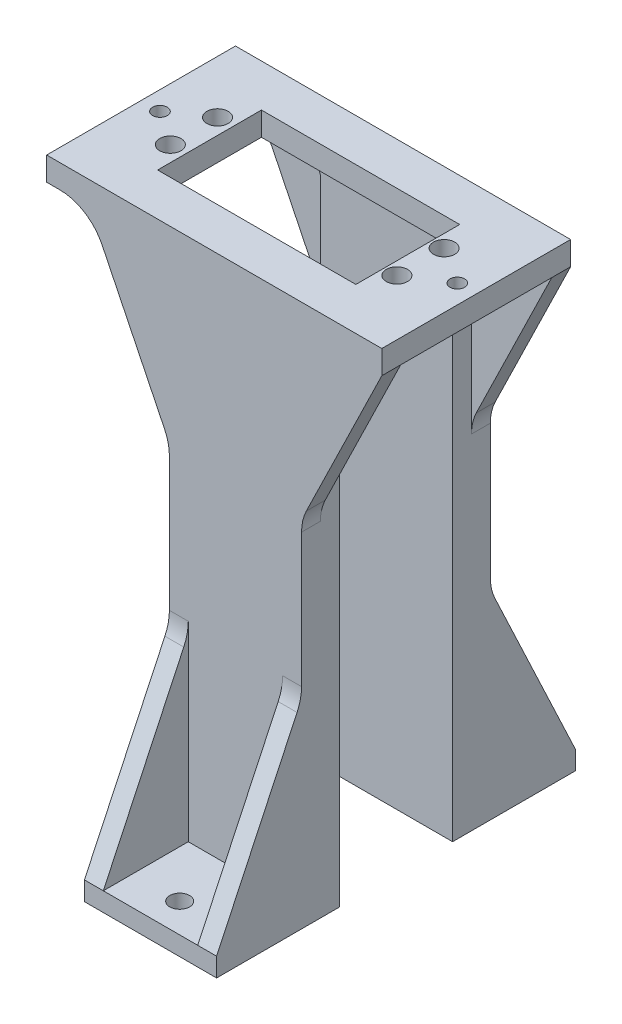
from build123d import *

# Parameters (mm, degrees)
SKETCH_1_W                                = 36
SKETCH_1_H                                = 30
EXTRUDE_1_DEPTH                           = 5
SKETCH_11_W                               = 36
SKETCH_11_H                               = 8
EXTRUDE_3_DEPTH                           = 110
SKETCH_12_W                               = 36
SKETCH_12_H                               = 8
EXTRUDE_4_DEPTH                           = 4
SKETCH_17_W                               = 36
SKETCH_17_H                               = 5
EXTRUDE_5_DEPTH                           = 8
SKETCH_18_W                               = 36
SKETCH_18_H                               = 5
EXTRUDE_6_DEPTH                           = 8
SKETCH_20_W                               = 36
SKETCH_20_H                               = 4
EXTRUDE_7_DEPTH                           = 15
SKETCH_21_W                               = 36
SKETCH_21_H                               = 4
EXTRUDE_8_DEPTH                           = 15
CUT_EXTRUDE_8_REACH                       = 124.446
SKETCH_22_R                               = 2.1
CUT_EXTRUDE_9_REACH                       = 124.446
SKETCH_23_R                               = 1.55
CUT_EXTRUDE_10_REACH                      = 119.762
SKETCH_26_R                               = 1
SKETCH_26_W                               = 23.5
SKETCH_26_H                               = 12
CUT_EXTRUDE_11_DEPTH                      = 2
CUT_EXTRUDE_12_DEPTH                      = 2
CUT_EXTRUDE_13_DEPTH                      = 2
CUT_EXTRUDE_14_DEPTH                      = 2
SKETCH_32_W                               = 28
SKETCH_32_H                               = 106
CUT_EXTRUDE_15_DEPTH                      = 2
SKETCH_33_W                               = 28
SKETCH_33_H                               = 106
CUT_EXTRUDE_16_DEPTH                      = 2
EXTRUDE_START                             = 2
SKETCH_34_W                               = 32
SKETCH_34_H                               = 14.000594261
SKETCH_34_R                               = 1
SKETCH_34_W_2                             = 23.5
SKETCH_34_H_2                             = 12
EXTRUDE_12_DEPTH                          = 2
CUT_EXTRUDE_START                         = -2
CUT_EXTRUDE_17_OUTLINE_R                  = 1
CUT_EXTRUDE_17_OUTLINE_W                  = 23.5
CUT_EXTRUDE_17_OUTLINE_H                  = 12
CUT_EXTRUDE_17_DEPTH                      = 2
SKETCH_36_W                               = 46
SKETCH_36_H                               = 5
EXTRUDE_13_DEPTH                          = 15
SKETCH_37_W                               = 46
SKETCH_37_H                               = 5
EXTRUDE_14_DEPTH                          = 15
SKETCH_38_R                               = 1.55
CUT_EXTRUDE_18_DEPTH                      = 5
CUT_EXTRUDE_19_REACH                      = 122.437
SKETCH_39_W                               = 62
SKETCH_39_H                               = 10
FILLET_3_R                                = 2
EXTRUDE_15_DEPTH                          = 7
EXTRUDE_16_DEPTH                          = 7
CUT_EXTRUDE_20_DEPTH                      = 5
CUT_EXTRUDE_21_DEPTH                      = 5
CUT_EXTRUDE_22_DEPTH                      = 5
SKETCH_46_W                               = 9
SKETCH_46_H                               = 40
SKETCH_46_R                               = 1.55
EXTRUDE_17_DEPTH                          = 5
EXTRUDE_18_DEPTH                          = 5
SKETCH_48_R                               = 2.25
CUT_EXTRUDE_23_DEPTH                      = 10
EXTRUDE_19_DEPTH                          = 4
MIRROR_1_AT_THE_SECOND_PLANE_COPY_1_DEPTH = 4
EXTRUDE_20_DEPTH                          = 4
MIRROR_2_AT_THE_SECOND_PLANE_COPY_1_DEPTH = 4
FILLET_4_R                                = 10


# Read off the part's stored shape, not the designer's step: 切除-拉伸17
with BuildPart() as part:
    # 草图1 → 凸台-拉伸1 (new body)
    with BuildSketch(Plane(origin=(0, 0, 0), x_dir=(1, 0, 0), z_dir=(0, 1, 0))):
        Rectangle(SKETCH_1_W, SKETCH_1_H)
    extrude(amount=EXTRUDE_1_DEPTH)

    # 草图11 → 凸台-拉伸3 (add)
    with BuildSketch(Plane.XZ):
        with Locations((0, 11)):
            Rectangle(SKETCH_11_W, SKETCH_11_H)
        with Locations((0, -11)):
            Rectangle(SKETCH_11_W, SKETCH_11_H)
    extrude(amount=EXTRUDE_3_DEPTH)

    # 草图12 → 凸台-拉伸4 (add)
    with BuildSketch(Plane.XZ.offset(110)):
        with Locations((0, 19)):
            Rectangle(SKETCH_12_W, SKETCH_12_H)
        with Locations((0, -19)):
            Rectangle(SKETCH_12_W, SKETCH_12_H)
    extrude(amount=-EXTRUDE_4_DEPTH)

    # 草图17 → 凸台-拉伸5 (add)
    with BuildSketch(Plane(origin=(0, 0, -15), x_dir=(-1, 0, 0), z_dir=(0, 0, -1))):
        with Locations((0, 2.5)):
            Rectangle(SKETCH_17_W, SKETCH_17_H)
    extrude(amount=EXTRUDE_5_DEPTH)

    # 草图18 → 凸台-拉伸6 (add)
    with BuildSketch(Plane.XY.offset(15)):
        with Locations((0, 2.5)):
            Rectangle(SKETCH_18_W, SKETCH_18_H)
    extrude(amount=EXTRUDE_6_DEPTH)

    # 草图20 → 凸台-拉伸7 (add)
    with BuildSketch(Plane.XY.offset(23)):
        with Locations((0, -108)):
            Rectangle(SKETCH_20_W, SKETCH_20_H)
    extrude(amount=EXTRUDE_7_DEPTH)

    # 草图21 → 凸台-拉伸8 (add)
    with BuildSketch(Plane(origin=(0, 0, -23), x_dir=(-1, 0, 0), z_dir=(0, 0, -1))):
        with Locations((0, -108)):
            Rectangle(SKETCH_21_W, SKETCH_21_H)
    extrude(amount=EXTRUDE_8_DEPTH)

    # 草图22 → 切除-拉伸8 (cut, up to next)
    with BuildSketch(Plane.XZ.offset(110), mode=Mode.PRIVATE) as cut_extrude_8_sk1:
        with Locations(Location((0, 31.819805155, 0), (0, 0, 270))):
            Circle(SKETCH_22_R)
    cut_extrude_8_tool1 = extrude(cut_extrude_8_sk1.sketch, amount=-CUT_EXTRUDE_8_REACH, mode=Mode.PRIVATE) & part.part
    # 草图22 → 切除-拉伸8 (cut, up to next)
    with BuildSketch(Plane.XZ.offset(110), mode=Mode.PRIVATE) as cut_extrude_8_sk2:
        with Locations(Location((0, -31.819805155, 0), (0, 0, 270))):
            Circle(SKETCH_22_R)
    cut_extrude_8_tool2 = extrude(cut_extrude_8_sk2.sketch, amount=-CUT_EXTRUDE_8_REACH, mode=Mode.PRIVATE) & part.part
    add(cut_extrude_8_tool1.solids().sort_by_distance((0, -110, 31.819805))[0], mode=Mode.SUBTRACT)
    add(cut_extrude_8_tool2.solids().sort_by_distance((0, -110, -31.819805))[0], mode=Mode.SUBTRACT)

    # 草图23 → 切除-拉伸9 (cut, up to next)
    with BuildSketch(Plane(origin=(0, 5, 0), x_dir=(1, 0, 0), z_dir=(0, 1, 0)), mode=Mode.PRIVATE) as cut_extrude_9_sk1:
        with Locations(Location((0, 18, 0), (0, 0, 270))):
            Circle(SKETCH_23_R)
    cut_extrude_9_tool1 = extrude(cut_extrude_9_sk1.sketch, amount=-CUT_EXTRUDE_9_REACH, mode=Mode.PRIVATE) & part.part
    # 草图23 → 切除-拉伸9 (cut, up to next)
    with BuildSketch(Plane(origin=(0, 5, 0), x_dir=(1, 0, 0), z_dir=(0, 1, 0)), mode=Mode.PRIVATE) as cut_extrude_9_sk2:
        with Locations(Location((0, -18, 0), (0, 0, 270))):
            Circle(SKETCH_23_R)
    cut_extrude_9_tool2 = extrude(cut_extrude_9_sk2.sketch, amount=-CUT_EXTRUDE_9_REACH, mode=Mode.PRIVATE) & part.part
    add(cut_extrude_9_tool1.solids().sort_by_distance((0, 5, -18))[0], mode=Mode.SUBTRACT)
    add(cut_extrude_9_tool2.solids().sort_by_distance((0, 5, 18))[0], mode=Mode.SUBTRACT)

    # 草图26 → 切除-拉伸10 (cut, up to next)
    with BuildSketch(Plane(origin=(0, 0, 0), x_dir=(-1, 0, 0), z_dir=(0, -1, 0)), mode=Mode.PRIVATE) as cut_extrude_10_sk1:
        with Locations(Location((-14, 0, 0), (0, 0, 90))):
            Circle(SKETCH_26_R)
    cut_extrude_10_tool1 = extrude(cut_extrude_10_sk1.sketch, amount=-CUT_EXTRUDE_10_REACH, mode=Mode.PRIVATE) & part.part
    # 草图26 → 切除-拉伸10 (cut, up to next)
    with BuildSketch(Plane(origin=(0, 0, 0), x_dir=(-1, 0, 0), z_dir=(0, -1, 0)), mode=Mode.PRIVATE) as cut_extrude_10_sk2:
        with Locations(Location((14, 0, 0), (0, 0, 270))):
            Circle(SKETCH_26_R)
    cut_extrude_10_tool2 = extrude(cut_extrude_10_sk2.sketch, amount=-CUT_EXTRUDE_10_REACH, mode=Mode.PRIVATE) & part.part
    # 草图26 → 切除-拉伸10 (cut, up to next)
    with BuildSketch(Plane(origin=(0, 0, 0), x_dir=(-1, 0, 0), z_dir=(0, -1, 0)), mode=Mode.PRIVATE) as cut_extrude_10_sk3:
        Rectangle(SKETCH_26_W, SKETCH_26_H)
    cut_extrude_10_tool3 = extrude(cut_extrude_10_sk3.sketch, amount=-CUT_EXTRUDE_10_REACH, mode=Mode.PRIVATE) & part.part
    add(cut_extrude_10_tool1.solids().sort_by_distance((14, 0, 0))[0], mode=Mode.SUBTRACT)
    add(cut_extrude_10_tool2.solids().sort_by_distance((-14, 0, 0))[0], mode=Mode.SUBTRACT)
    add(cut_extrude_10_tool3.solids().sort_by_distance((0, 0, 0))[0], mode=Mode.SUBTRACT)

    # 草图28 → 切除-拉伸11 (cut)
    with BuildSketch(Plane(origin=(18, 0, 0), x_dir=(0, 0, -1), z_dir=(1, 0, 0))):
        Polygon((23, 5), (-23, 5), (-23, 0), (-15, 0), (-15, -106), (-38, -106), (-38, -110), (-7, -110), (-7, 0), (7, 0), (7, -110), (38, -110), (38, -106), (15, -106), (15, 0), (23, 0), align=None)
    extrude(amount=-CUT_EXTRUDE_11_DEPTH, mode=Mode.SUBTRACT)

    # 草图29 → 切除-拉伸12 (cut)
    with BuildSketch(Plane.ZY.offset(18)):
        Polygon((23, 5), (-23, 5), (-23, 0), (-15, 0), (-15, -106), (-38, -106), (-38, -110), (-7, -110), (-7, 0), (7, 0), (7, -110), (38, -110), (38, -106), (15, -106), (15, 0), (23, 0), align=None)
    extrude(amount=-CUT_EXTRUDE_12_DEPTH, mode=Mode.SUBTRACT)

    # 草图30 → 切除-拉伸13 (cut)
    with BuildSketch(Plane(origin=(16, 0, 0), x_dir=(0, 0, -1), z_dir=(1, 0, 0))):
        Polygon((-15, 0), (-7, 0), (-7, -110), (-38, -110), (-38, -106), (-15, -106), align=None)
        Polygon((7, 0), (15, 0), (15, -106), (38, -106), (38, -110), (7, -110), align=None)
    extrude(amount=-CUT_EXTRUDE_13_DEPTH, mode=Mode.SUBTRACT)

    # 草图31 → 切除-拉伸14 (cut)
    with BuildSketch(Plane.ZY.offset(16)):
        Polygon((-7, 0), (-7, -110), (-38, -110), (-38, -106), (-15, -106), (-15, 0), align=None)
        Polygon((15, 0), (15, -106), (38, -106), (38, -110), (7, -110), (7, 0), align=None)
    extrude(amount=-CUT_EXTRUDE_14_DEPTH, mode=Mode.SUBTRACT)

    # 草图32 → 切除-拉伸15 (cut)
    with BuildSketch(Plane.XY.offset(15)):
        with Locations((0, -53)):
            Rectangle(SKETCH_32_W, SKETCH_32_H)
    extrude(amount=-CUT_EXTRUDE_15_DEPTH, mode=Mode.SUBTRACT)

    # 草图33 → 切除-拉伸16 (cut)
    with BuildSketch(Plane(origin=(0, 0, -15), x_dir=(-1, 0, 0), z_dir=(0, 0, -1))):
        with Locations((0, -53)):
            Rectangle(SKETCH_33_W, SKETCH_33_H)
    extrude(amount=-CUT_EXTRUDE_16_DEPTH, mode=Mode.SUBTRACT)

    # 草图34 → 凸台-拉伸12 (add)
    with BuildSketch(Plane.XZ.offset(EXTRUDE_START)):
        with Locations((0, 0.000297131)):
            Rectangle(SKETCH_34_W, SKETCH_34_H)
        with Locations(Location((14, 0, 0), (0, 0, 270))):
            Circle(SKETCH_34_R, mode=Mode.SUBTRACT)
        with Locations(Location((-14, 0, 0), (0, 0, 270))):
            Circle(SKETCH_34_R, mode=Mode.SUBTRACT)
        Rectangle(SKETCH_34_W_2, SKETCH_34_H_2, mode=Mode.SUBTRACT)
    extrude(amount=-EXTRUDE_12_DEPTH)

    # 切除-拉伸17 outline → 切除-拉伸17 (cut)
    with BuildSketch(Plane.XZ.offset(2).offset(CUT_EXTRUDE_START)):
        Polygon((-16, -7), (16, -7), (16, 7.000594261), (14, 7.000594261), (14, 7), (-14, 7), (-14, 7.000594261), (-16, 7.000594261), align=None)
        with Locations((-14, 0)):
            Circle(CUT_EXTRUDE_17_OUTLINE_R, mode=Mode.SUBTRACT)
        Rectangle(CUT_EXTRUDE_17_OUTLINE_W, CUT_EXTRUDE_17_OUTLINE_H, mode=Mode.SUBTRACT)
        with Locations((14, 0)):
            Circle(CUT_EXTRUDE_17_OUTLINE_R, mode=Mode.SUBTRACT)
    extrude(amount=CUT_EXTRUDE_17_DEPTH, mode=Mode.SUBTRACT)

    # 草图36 → 凸台-拉伸13 (add)
    with BuildSketch(Plane.ZY.offset(16)):
        with Locations((0, 2.5)):
            Rectangle(SKETCH_36_W, SKETCH_36_H)
    extrude(amount=EXTRUDE_13_DEPTH)

    # 草图37 → 凸台-拉伸14 (add)
    with BuildSketch(Plane(origin=(16, 0, 0), x_dir=(0, 0, -1), z_dir=(1, 0, 0))):
        with Locations((0, 2.5)):
            Rectangle(SKETCH_37_W, SKETCH_37_H)
    extrude(amount=EXTRUDE_14_DEPTH)

    # 草图38 → 切除-拉伸18 (cut)
    with BuildSketch(Plane.XZ):
        with Locations(Location((-27, 0, 0), (0, 0, 270))):
            Circle(SKETCH_38_R)
        with Locations(Location((27, 0, 0), (0, 0, 90))):
            Circle(SKETCH_38_R)
    extrude(amount=-CUT_EXTRUDE_18_DEPTH, mode=Mode.SUBTRACT)

    # 草图39 → 切除-拉伸19 (cut, up to next)
    with BuildSketch(Plane.XZ, mode=Mode.PRIVATE) as cut_extrude_19_sk1:
        with Locations((0, 18)):
            Rectangle(SKETCH_39_W, SKETCH_39_H)
    cut_extrude_19_tool1 = extrude(cut_extrude_19_sk1.sketch, amount=-CUT_EXTRUDE_19_REACH, mode=Mode.PRIVATE) & part.part
    # 草图39 → 切除-拉伸19 (cut, up to next)
    with BuildSketch(Plane.XZ, mode=Mode.PRIVATE) as cut_extrude_19_sk2:
        with Locations((0, -18)):
            Rectangle(SKETCH_39_W, SKETCH_39_H)
    cut_extrude_19_tool2 = extrude(cut_extrude_19_sk2.sketch, amount=-CUT_EXTRUDE_19_REACH, mode=Mode.PRIVATE) & part.part
    add(cut_extrude_19_tool1.solids().sort_by_distance((0, 0, 18))[0], mode=Mode.SUBTRACT)
    add(cut_extrude_19_tool2.solids().sort_by_distance((0, 0, -18))[0], mode=Mode.SUBTRACT)

    # 圆角3
    fillet_3_edges = [part.edges().sort_by_distance(p)[0] for p in [
        (-14, 0, -10),
        (-14, 0, 10),
        (14, 0, -10),
        (14, 0, 10),
    ]]
    fillet(fillet_3_edges, radius=FILLET_3_R)

    # 草图40 → 凸台-拉伸15 (add)
    with BuildSketch(Plane.XY.offset(13)):
        with BuildLine():
            Line((14, -106), (14, -2))
            ThreePointArc((14, -2), (14.585786438, -0.585786438), (16, 0))
            Line((16, 0), (31, 0))
            Line((31, 0), (31, 5))
            Line((31, 5), (-31, 5))
            Line((-31, 5), (-31, 0))
            Line((-31, 0), (-16, 0))
            ThreePointArc((-16, 0), (-14.585786438, -0.585786438), (-14, -2))
            Line((-14, -2), (-14, -106))
            Line((-14, -106), (14, -106))
        make_face()
    extrude(amount=EXTRUDE_15_DEPTH)

    # 草图41 → 凸台-拉伸16 (add)
    with BuildSketch(Plane(origin=(0, 0, -13), x_dir=(-1, 0, 0), z_dir=(0, 0, -1))):
        with BuildLine():
            Line((-31, 0), (-16, 0))
            ThreePointArc((-16, 0), (-14.585786438, -0.585786438), (-14, -2))
            Line((-14, -2), (-14, -106))
            Line((-14, -106), (14, -106))
            Line((14, -106), (14, -2))
            ThreePointArc((14, -2), (14.585786438, -0.585786438), (16, 0))
            Line((16, 0), (31, 0))
            Line((31, 0), (31, 5))
            Line((31, 5), (-31, 5))
            Line((-31, 5), (-31, 0))
        make_face()
    extrude(amount=EXTRUDE_16_DEPTH)

    # 草图42 → 切除-拉伸20 (cut)
    with BuildSketch(Plane(origin=(0, 0, 7), x_dir=(-1, 0, 0), z_dir=(0, 0, -1))):
        with BuildLine():
            Line((14, -110), (14, -2))
            ThreePointArc((14, -2), (14.585786438, -0.585786438), (16, 0))
            Line((16, 0), (-16, 0))
            ThreePointArc((-16, 0), (-14.585786438, -0.585786438), (-14, -2))
            Line((-14, -2), (-14, -110))
            Line((-14, -110), (14, -110))
        make_face()
    extrude(amount=-CUT_EXTRUDE_20_DEPTH, mode=Mode.SUBTRACT)

    # 草图43 → 切除-拉伸21 (cut)
    with BuildSketch(Plane.XY.offset(-7)):
        with BuildLine():
            Line((-14, -110), (14, -110))
            Line((14, -110), (14, -2))
            ThreePointArc((14, -2), (14.585786438, -0.585786438), (16, 0))
            Line((16, 0), (-16, 0))
            ThreePointArc((-16, 0), (-14.585786438, -0.585786438), (-14, -2))
            Line((-14, -2), (-14, -110))
        make_face()
    extrude(amount=-CUT_EXTRUDE_21_DEPTH, mode=Mode.SUBTRACT)

    # 草图45 → 切除-拉伸22 (cut)
    with BuildSketch(Plane.XZ):
        with BuildLine():
            Line((-25.5, -11), (16.5, -11))
            Line((16.5, -11), (16.5, 0))
            Line((16.5, 0), (15, 0))
            ThreePointArc((15, 0), (14, -1), (13, 0))
            Line((13, 0), (11.75, 0))
            Line((11.75, 0), (11.75, -6))
            Line((11.75, -6), (-11.75, -6))
            Line((-11.75, -6), (-11.75, 0))
            Line((-11.75, 0), (-13, 0))
            ThreePointArc((-13, 0), (-14, -1), (-15, 0))
            Line((-15, 0), (-25.45, 0))
            ThreePointArc((-25.45, 0), (-25.462550814, -0.196850197), (-25.5, -0.390512484))
            Line((-25.5, -0.390512484), (-25.5, -11))
        make_face()
        with BuildLine():
            Line((15, 0), (16.5, 0))
            Line((16.5, 0), (16.5, 11))
            Line((16.5, 11), (-25.5, 11))
            Line((-25.5, 11), (-25.5, 0.390512484))
            ThreePointArc((-25.5, 0.390512484), (-25.462550814, 0.196850197), (-25.45, 0))
            Line((-25.45, 0), (-15, 0))
            ThreePointArc((-15, 0), (-14, 1), (-13, 0))
            Line((-13, 0), (-11.75, 0))
            Line((-11.75, 0), (-11.75, 6))
            Line((-11.75, 6), (11.75, 6))
            Line((11.75, 6), (11.75, 0))
            Line((11.75, 0), (13, 0))
            ThreePointArc((13, 0), (14, 1), (15, 0))
        make_face()
    extrude(amount=-CUT_EXTRUDE_22_DEPTH, mode=Mode.SUBTRACT)

    # 草图46 → 凸台-拉伸17 (add)
    with BuildSketch(Plane.XZ):
        with Locations((-35.5, 0)):
            Rectangle(SKETCH_46_W, SKETCH_46_H)
        with Locations(Location((-36, 0, 0), (0, 0, 270))):
            Circle(SKETCH_46_R, mode=Mode.SUBTRACT)
    extrude(amount=-EXTRUDE_17_DEPTH)

    # 草图47 → 凸台-拉伸18 (add)
    with BuildSketch(Plane.XZ):
        with BuildLine():
            Line((-25.5, 0.390512484), (-25.5, -0.390512484))
            ThreePointArc((-25.5, -0.390512484), (-28.55, 0), (-25.5, 0.390512484))
        make_face()
    extrude(amount=-EXTRUDE_18_DEPTH)

    # 草图48 → 切除-拉伸23 (cut)
    with BuildSketch(Plane.XZ):
        with Locations(Location((-28.8, 5, 0), (0, 0, 270))):
            Circle(SKETCH_48_R)
        with Locations(Location((-28.8, -5, 0), (0, 0, 270))):
            Circle(SKETCH_48_R)
        with Locations(Location((19.2, 5, 0), (0, 0, 270))):
            Circle(SKETCH_48_R)
        with Locations(Location((19.2, -5, 0), (0, 0, 270))):
            Circle(SKETCH_48_R)
    extrude(amount=-CUT_EXTRUDE_23_DEPTH, mode=Mode.SUBTRACT)

    # 草图49 → 凸台-拉伸19 (add)
    with BuildSketch(Plane.ZY.offset(14)):
        Polygon((20, -67.780962131), (38, -106), (20, -106), align=None)
    extrude_19 = extrude(amount=-EXTRUDE_19_DEPTH)

    # 镜向1: 凸台-拉伸19 across plane
    add(extrude_19.mirror(Plane(origin=(0, 0, 0), x_dir=(1, 0, 0), z_dir=(0, 0, -1))))

    # 镜向1 at the second plane: 凸台-拉伸19 across plane
    add(extrude_19.mirror(Plane.ZY))

    # 镜向1 at the second plane copy 1 sket → 镜向1 at the second plane copy 1 (add)
    with BuildSketch(Plane(origin=(14, 0, 0), x_dir=(0, 0, -1), z_dir=(1, 0, 0))):
        Polygon((20, -67.780962131), (38, -106), (20, -106), align=None)
    extrude(amount=-MIRROR_1_AT_THE_SECOND_PLANE_COPY_1_DEPTH)

    # 草图50 → 凸台-拉伸20 (add)
    with BuildSketch(Plane(origin=(0, 0, -20), x_dir=(-1, 0, 0), z_dir=(0, 0, -1))):
        Polygon((-31, 0), (-14, -34.890481065), (-14, 1.365552743), align=None)
    extrude_20 = extrude(amount=-EXTRUDE_20_DEPTH)

    # 镜向2: 凸台-拉伸20 across plane
    add(extrude_20.mirror(Plane(origin=(0, 0, 0), x_dir=(1, 0, 0), z_dir=(0, 0, -1))))

    # 镜向2 at the second plane: 凸台-拉伸20 across plane
    add(extrude_20.mirror(Plane.ZY))

    # 镜向2 at the second plane copy 1 sket → 镜向2 at the second plane copy 1 (add)
    with BuildSketch(Plane.XY.offset(20)):
        Polygon((-31, 0), (-14, -34.890481065), (-14, 1.365552743), align=None)
    extrude(amount=-MIRROR_2_AT_THE_SECOND_PLANE_COPY_1_DEPTH)

    # 圆角4
    fillet_4_edges = [part.edges().sort_by_distance(p)[0] for p in [
        (-31, 0, 18),
        (-14, -34.890481065, 18),
        (-12, -67.780962131, 20),
        (12, -67.780962131, 20),
        (-12, -67.780962131, -20),
        (12, -67.780962131, -20),
        (14, -34.890481065, -18),
        (-31, 0, -18),
        (14, -34.890481065, 18),
    ]]
    fillet(fillet_4_edges, radius=FILLET_4_R)


solid = part.part
